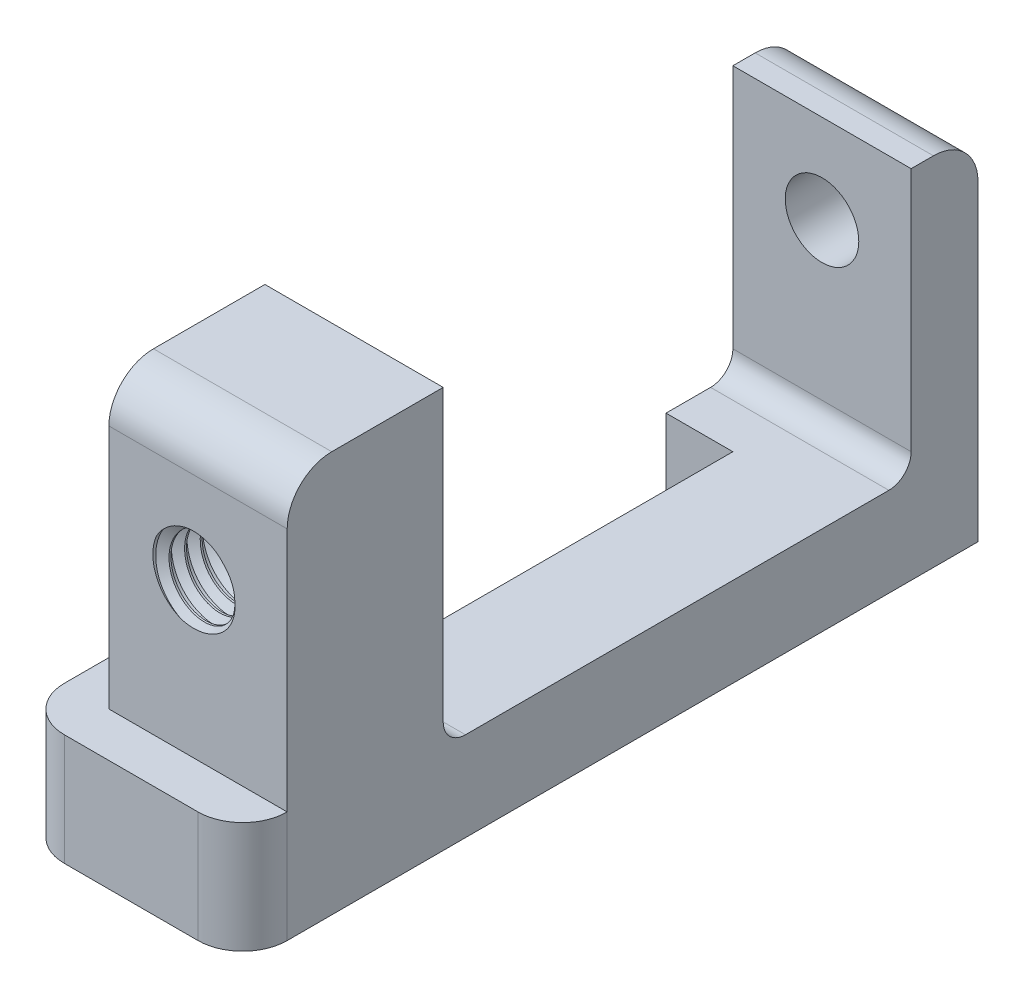
from build123d import *

# Parameters (mm, degrees)
BOSS_EXTRUDE1_DEPTH = 8
CUT_EXTRUDE2_DEPTH  = 21
BOSS_EXTRUDE2_DEPTH = 3
BOSS_EXTRUDE5_DEPTH = 5
SKETCH6_R           = 1.65
CUT_EXTRUDE3_DEPTH  = 38.215588132
FILLET1_R           = 2
THREAD1_PITCH       = 0.7
THREAD2_PITCH       = 0.5
THREAD3_PITCH       = 0.5
FILLET2_R           = 1


# Read off the part's stored shape, not the designer's step: Tap Drill for M3x0.5 Tap, Tap Drill for M3x0.5 Tap
with BuildPart() as part:
    # Sketch1 → Boss-Extrude1 (new body)
    with BuildSketch(Plane(origin=(0, 0, 0), x_dir=(0, 0, -1), z_dir=(1, 0, 0))):
        Polygon((0, 0), (0, 16), (-3, 16), (-3, 4), (-24, 4), (-24, 18), (-31, 18), (-31, 0), align=None)
    extrude(amount=-BOSS_EXTRUDE1_DEPTH)

    # Sketch5 → Cut-Extrude2 (cut)
    with BuildSketch(Plane.XY.offset(3)):
        Polygon((-8, 0), (-3, 0), (-5, 4), (-8, 4), align=None)
    extrude(amount=CUT_EXTRUDE2_DEPTH, mode=Mode.SUBTRACT)

    # Sketch8 → Boss-Extrude2 (add)
    with BuildSketch(Plane.XY.offset(3)):
        Polygon((-8, 4), (-5, 4), (-3, 0), (-8, 0), align=None)
    extrude(amount=BOSS_EXTRUDE2_DEPTH)

    # Sketch11 → Boss-Extrude5 (add)
    with BuildSketch(Plane.XZ):
        with BuildLine():
            Line((-10, 26), (-10, 33))
            Line((-10, 33), (-2, 33))
            ThreePointArc((-2, 33), (-0.585786438, 32.414213562), (0, 31))
            Line((0, 31), (-8, 31))
            Line((-8, 31), (-8, 24))
            ThreePointArc((-8, 24), (-9.414213562, 24.585786438), (-10, 26))
        make_face()
    extrude(amount=-BOSS_EXTRUDE5_DEPTH)

    # Sketch6 → Cut-Extrude3 (cut, through all)
    with BuildSketch(Plane.XY.offset(31)):
        with Locations((-4, 12)):
            Circle(SKETCH6_R)
    extrude(amount=-CUT_EXTRUDE3_DEPTH, mode=Mode.SUBTRACT)

    # Fillet1
    fillet1_edges = [part.edges().sort_by_distance(p)[0] for p in [
        (-4, 18, 31),
        (-4, 16, 0),
        (-10, 2.5, 33),
    ]]
    fillet(fillet1_edges, radius=FILLET1_R)

    # Tap Drill for M3x0.5 Tap outline → Tap Drill for M3x0.5 Tap (revolve, cut)
    with BuildSketch(Plane(origin=(-4.1, 0, 3), x_dir=(1, 0, 0), z_dir=(0, 0, 1))):
        Polygon((1.25, 3), (0, 3.751075774), (0, 0), (1.25, 0), align=None)
    revolve(axis=Axis((-4.1, 0, 3), (0, 1, 0)), mode=Mode.SUBTRACT)

    # Tap Drill for M3x0.5 Tap 2 outline → Tap Drill for M3x0.5 Tap 2 (revolve, cut)
    with BuildSketch(Plane(origin=(-5.815, 0, 29), x_dir=(1, 0, 0), z_dir=(0, 0, 1))):
        Polygon((1.25, 3), (0, 3.751075774), (0, 0), (1.25, 0), align=None)
    revolve(axis=Axis((-5.815, 0, 29), (0, 1, 0)), mode=Mode.SUBTRACT)

    # Thread1: the profile of Thread Profile1 profile screwed along a right-hand helix of 10 turns, 6 arcs to a turn; built about Z, then put on its axis
    thread1_z = Axis((0, 0, 0), (0, 0, 1))
    thread1_corners = [(1.6497, 0, 0.612673207), (1.6497, 0, -0.000173205), (2.028886116, 0, 0.218750001), (2.028886116, 0, 0.393750001)]
    with BuildLine(mode=Mode.PRIVATE) as thread1_profile:
        Line(thread1_corners[0], thread1_corners[1])
        Line(thread1_corners[1], thread1_corners[2])
        Line(thread1_corners[2], thread1_corners[3])
        Line(thread1_corners[3], thread1_corners[0])
    thread1_cap = Face(thread1_profile.wire())
    thread1_turn_angles = [0, 30, 60, 90, 120, 150, 180, 210, 240, 270, 300, 330, 360]
    thread1_turn_weights = [1, 0.8660254037844387, 1, 0.8660254037844387, 1, 0.8660254037844387, 1, 0.8660254037844387, 1, 0.8660254037844387, 1, 0.8660254037844387, 1]
    thread1_turn_rails = [Edge.make_bspline([Vector(p[0], p[1], 0).rotate(thread1_z, thread1_turn_angles[k]) / thread1_turn_weights[k] + Vector(0, 0, p[2] + THREAD1_PITCH * thread1_turn_angles[k] / 360) for k in range(13)], [0, 0, 0, 1, 1, 2, 2, 3, 3, 4, 4, 5, 5, 6, 6, 6], 2, thread1_turn_weights) for p in thread1_corners]
    thread1_turn_sides = [Face.make_surface_from_curves(thread1_turn_rails[p[0]], thread1_turn_rails[p[1]]) for p in [(0, 1), (1, 2), (2, 3), (3, 0)]]
    thread1 = Plane(origin=(-4, 12, 24), x_dir=(1, 0, 0), z_dir=(0, 0, 1)) * Solid(Shell([*[p.moved(Location((0, 0, THREAD1_PITCH * i))) for i in range(10) for p in thread1_turn_sides], thread1_cap, thread1_cap.rotate(thread1_z, 3600).moved(Location((0, 0, THREAD1_PITCH * 3600 / 360)))]))
    add(thread1, mode=Mode.SUBTRACT)

    # Thread2: the profile of Thread Profile2 profile screwed along a right-hand helix of 6 turns, 6 arcs to a turn; built about Z, then put on its axis
    thread2_z = Axis((0, 0, 0), (0, 0, 1))
    thread2_corners = [(1.2497, 0, -0.000173205), (1.520632937, 0, 0.156249999), (1.520632937, 0, 0.218749999), (1.2497, 0, 0.375173204)]
    with BuildLine(mode=Mode.PRIVATE) as thread2_profile:
        Line(thread2_corners[0], thread2_corners[1])
        Line(thread2_corners[1], thread2_corners[2])
        Line(thread2_corners[2], thread2_corners[3])
        Line(thread2_corners[3], thread2_corners[0])
    thread2_cap = Face(thread2_profile.wire())
    thread2_turn_angles = [0, 30, 60, 90, 120, 150, 180, 210, 240, 270, 300, 330, 360]
    thread2_turn_weights = [1, 0.8660254037844387, 1, 0.8660254037844387, 1, 0.8660254037844387, 1, 0.8660254037844387, 1, 0.8660254037844387, 1, 0.8660254037844387, 1]
    thread2_turn_rails = [Edge.make_bspline([Vector(p[0], p[1], 0).rotate(thread2_z, thread2_turn_angles[k]) / thread2_turn_weights[k] + Vector(0, 0, p[2] + THREAD2_PITCH * thread2_turn_angles[k] / 360) for k in range(13)], [0, 0, 0, 1, 1, 2, 2, 3, 3, 4, 4, 5, 5, 6, 6, 6], 2, thread2_turn_weights) for p in thread2_corners]
    thread2_turn_sides = [Face.make_surface_from_curves(thread2_turn_rails[p[0]], thread2_turn_rails[p[1]]) for p in [(0, 1), (1, 2), (2, 3), (3, 0)]]
    thread2 = Plane(origin=(-5.815, 0, 29), x_dir=(1, 0, 0), z_dir=(0, 1, 0)) * Solid(Shell([*[p.moved(Location((0, 0, THREAD2_PITCH * i))) for i in range(6) for p in thread2_turn_sides], thread2_cap, thread2_cap.rotate(thread2_z, 2160).moved(Location((0, 0, THREAD2_PITCH * 2160 / 360)))]))
    add(thread2, mode=Mode.SUBTRACT)

    # Thread3: the profile of Thread Profile3 profile screwed along a right-hand helix of 6 turns, 6 arcs to a turn; built about Z, then put on its axis
    thread3_z = Axis((0, 0, 0), (0, 0, 1))
    thread3_corners = [(1.2497, 0, -0.000173205), (1.520632938, 0, 0.156249999), (1.520632938, 0, 0.218749999), (1.2497, 0, 0.375173204)]
    with BuildLine(mode=Mode.PRIVATE) as thread3_profile:
        Line(thread3_corners[0], thread3_corners[1])
        Line(thread3_corners[1], thread3_corners[2])
        Line(thread3_corners[2], thread3_corners[3])
        Line(thread3_corners[3], thread3_corners[0])
    thread3_cap = Face(thread3_profile.wire())
    thread3_turn_angles = [0, 30, 60, 90, 120, 150, 180, 210, 240, 270, 300, 330, 360]
    thread3_turn_weights = [1, 0.8660254037844387, 1, 0.8660254037844387, 1, 0.8660254037844387, 1, 0.8660254037844387, 1, 0.8660254037844387, 1, 0.8660254037844387, 1]
    thread3_turn_rails = [Edge.make_bspline([Vector(p[0], p[1], 0).rotate(thread3_z, thread3_turn_angles[k]) / thread3_turn_weights[k] + Vector(0, 0, p[2] + THREAD3_PITCH * thread3_turn_angles[k] / 360) for k in range(13)], [0, 0, 0, 1, 1, 2, 2, 3, 3, 4, 4, 5, 5, 6, 6, 6], 2, thread3_turn_weights) for p in thread3_corners]
    thread3_turn_sides = [Face.make_surface_from_curves(thread3_turn_rails[p[0]], thread3_turn_rails[p[1]]) for p in [(0, 1), (1, 2), (2, 3), (3, 0)]]
    thread3 = Plane(origin=(-4.1, 0, 3), x_dir=(1, 0, 0), z_dir=(0, 1, 0)) * Solid(Shell([*[p.moved(Location((0, 0, THREAD3_PITCH * i))) for i in range(6) for p in thread3_turn_sides], thread3_cap, thread3_cap.rotate(thread3_z, 2160).moved(Location((0, 0, THREAD3_PITCH * 2160 / 360)))]))
    add(thread3, mode=Mode.SUBTRACT)

    # Fillet2
    fillet2_edges = [part.edges().sort_by_distance(p)[0] for p in [
        (-4, 4, 3),
        (-2.5, 4, 24),
    ]]
    fillet(fillet2_edges, radius=FILLET2_R)


solid = part.part
